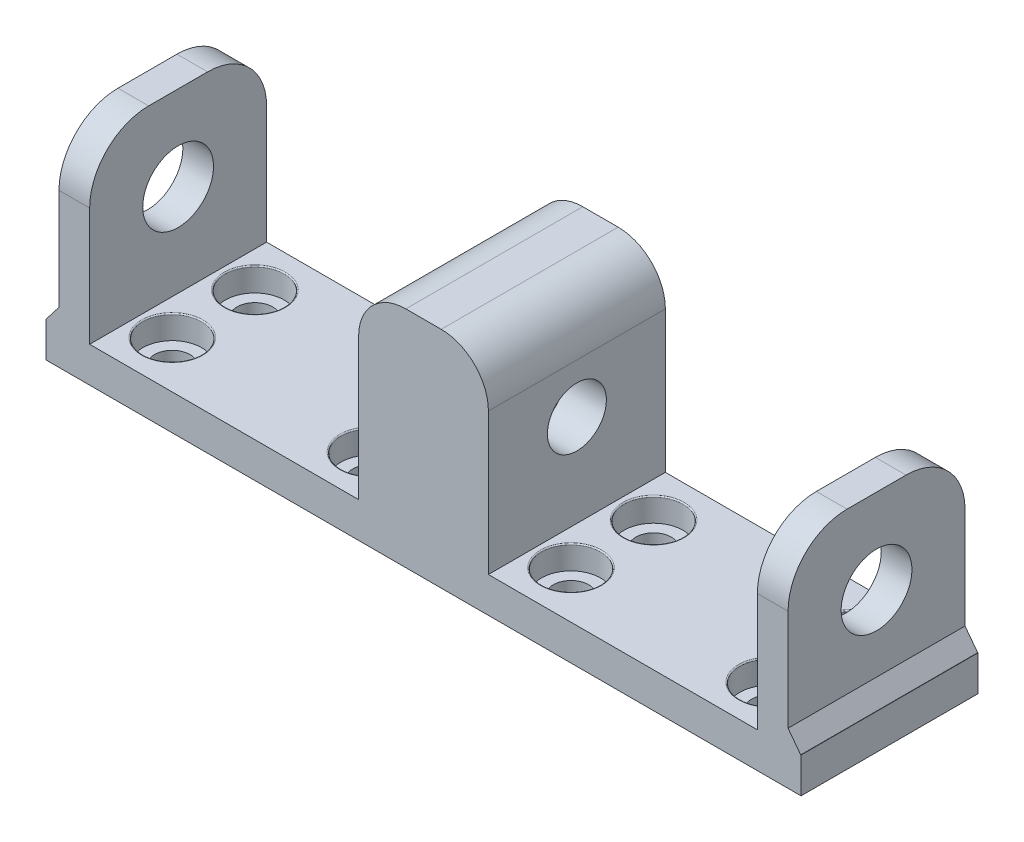
from build123d import *

# Parameters (mm, degrees)
SALIENTE_EXTRUIR1_DEPTH = 15
CROQUIS2_R              = 2.5
CORTAR_EXTRUIR1_DEPTH   = 3.5
CORTAR_EXTRUIR2_START   = -3.5
CROQUIS3_R              = 2.5
CORTAR_EXTRUIR2_DEPTH   = 3.5
CROQUIS4_R              = 2.5
CORTAR_EXTRUIR3_DEPTH   = 2
REDONDEO1_R             = 0.1
CROQUIS5_R              = 1.5
CORTAR_EXTRUIR4_DEPTH   = 25.763884994
CROQUIS6_W              = 15
CROQUIS6_H              = 3
SALIENTE_EXTRUIR2_DEPTH = 20.5
CROQUIS7_W              = 15
CROQUIS7_H              = 3
SALIENTE_EXTRUIR3_DEPTH = 20.5
CROQUIS8_W              = 2.6
CROQUIS8_H              = 15
SALIENTE_EXTRUIR4_DEPTH = 15
REDONDEO4_R             = 5
REDONDEO5_R             = 5
NERVIO1_REACH           = 36.213
CROQUIS17_WALL_W        = 72.20311249
CROQUIS17_WALL_H        = 15
NERVIO2_REACH           = 36.213
CROQUIS22_WALL_W        = 72.215787752
CROQUIS22_WALL_H        = 15
CROQUIS23_R             = 3
CORTAR_EXTRUIR5_DEPTH   = 7
CORTAR_EXTRUIR6_START   = -7
CROQUIS24_R             = 3
CORTAR_EXTRUIR6_DEPTH   = 7
CROQUIS27_R             = 1.5
CORTAR_EXTRUIR8_DEPTH   = 39.794329483
CROQUIS29_R             = 2.5
CORTAR_EXTRUIR9_DEPTH   = 2
REDONDEO6_R             = 0.1
CROQUIS30_R             = 1.5
CORTAR_EXTRUIR10_DEPTH  = 39.794329483
CROQUIS32_R             = 2.5
CORTAR_EXTRUIR11_DEPTH  = 2
REDONDEO7_R             = 0.1


with BuildPart() as part:
    # Croquis1 → Saliente-Extruir1 (new body)
    with BuildSketch(Plane.XY):
        with BuildLine():
            Line((-1.5, 9.5), (1.5, 9.5))
            ThreePointArc((1.5, 9.5), (4.328427125, 8.328427125), (5.5, 5.5))
            Line((5.5, 5.5), (5.5, -6.5))
            Line((5.5, -6.5), (11.5, -6.5))
            Line((11.5, -6.5), (11.5, -9.5))
            Line((11.5, -9.5), (5.5, -9.5))
            Line((5.5, -9.5), (-5.5, -9.5))
            Line((-5.5, -9.5), (-11.5, -9.5))
            Line((-11.5, -9.5), (-11.5, -6.5))
            Line((-11.5, -6.5), (-5.5, -6.5))
            Line((-5.5, -6.5), (-5.5, 5.5))
            ThreePointArc((-5.5, 5.5), (-4.328427125, 8.328427125), (-1.5, 9.5))
        make_face()
    extrude(amount=-SALIENTE_EXTRUIR1_DEPTH)

    # Croquis2 → Cortar-Extruir1 (cut)
    with BuildSketch(Plane(origin=(5.5, 0, 0), x_dir=(0, 0, -1), z_dir=(1, 0, 0))):
        with Locations((7.5, 1.32)):
            Circle(CROQUIS2_R)
    extrude(amount=-CORTAR_EXTRUIR1_DEPTH, mode=Mode.SUBTRACT)

    # Croquis3 → Cortar-Extruir2 (cut)
    with BuildSketch(Plane.ZY.offset(5.5).offset(CORTAR_EXTRUIR2_START)):
        with Locations((-7.5, 1.32)):
            Circle(CROQUIS3_R)
    extrude(amount=CORTAR_EXTRUIR2_DEPTH, mode=Mode.SUBTRACT)

    # Croquis4 → Cortar-Extruir3 (cut)
    with BuildSketch(Plane(origin=(0, -6.5, 0), x_dir=(1, 0, 0), z_dir=(0, 1, 0))):
        with Locations((-8.5, 11)):
            Circle(CROQUIS4_R)
        with Locations((-8.5, 4)):
            Circle(CROQUIS4_R)
        with Locations((8.5, 4)):
            Circle(CROQUIS4_R)
        with Locations((8.5, 11)):
            Circle(CROQUIS4_R)
    extrude(amount=-CORTAR_EXTRUIR3_DEPTH, mode=Mode.SUBTRACT)

    # Redondeo1
    redondeo1_edges = [part.edges().sort_by_distance(p)[0] for p in [
        (6, -6.5, -4),
        (6, -6.5, -11),
        (-11, -6.5, -4),
        (-11, -6.5, -11),
    ]]
    fillet(redondeo1_edges, radius=REDONDEO1_R)

    # Croquis5 → Cortar-Extruir4 (cut, through all)
    with BuildSketch(Plane(origin=(0, -6.5, 0), x_dir=(1, 0, 0), z_dir=(0, 1, 0))):
        with Locations((-8.5, 11)):
            Circle(CROQUIS5_R)
        with Locations((-8.5, 4)):
            Circle(CROQUIS5_R)
        with Locations((8.5, 4)):
            Circle(CROQUIS5_R)
        with Locations((8.5, 11)):
            Circle(CROQUIS5_R)
    extrude(amount=-CORTAR_EXTRUIR4_DEPTH, mode=Mode.SUBTRACT)

    # Croquis6 → Saliente-Extruir2 (add)
    with BuildSketch(Plane.ZY.offset(11.5)):
        with Locations((-7.5, -8)):
            Rectangle(CROQUIS6_W, CROQUIS6_H)
    extrude(amount=SALIENTE_EXTRUIR2_DEPTH)

    # Croquis7 → Saliente-Extruir3 (add)
    with BuildSketch(Plane(origin=(11.5, 0, 0), x_dir=(0, 0, -1), z_dir=(1, 0, 0))):
        with Locations((7.5, -8)):
            Rectangle(CROQUIS7_W, CROQUIS7_H)
    extrude(amount=SALIENTE_EXTRUIR3_DEPTH)

    # Croquis8 → Saliente-Extruir4 (add)
    with BuildSketch(Plane(origin=(0, -6.5, 0), x_dir=(1, 0, 0), z_dir=(0, 1, 0))):
        with Locations((-29.6, 7.5)):
            Rectangle(CROQUIS8_W, CROQUIS8_H)
        with Locations((29.6, 7.5)):
            Rectangle(CROQUIS8_W, CROQUIS8_H)
    extrude(amount=SALIENTE_EXTRUIR4_DEPTH)

    # Redondeo4
    redondeo4_edges = [part.edges().sort_by_distance(p)[0] for p in [
        (-29.6, 8.5, -15),
        (-29.6, 8.5, 0),
    ]]
    fillet(redondeo4_edges, radius=REDONDEO4_R)

    # Redondeo5
    redondeo5_edges = [part.edges().sort_by_distance(p)[0] for p in [
        (29.6, 8.5, -15),
        (29.6, 8.5, 0),
    ]]
    fillet(redondeo5_edges, radius=REDONDEO5_R)

    # Croquis17 wall → Nervio1 (add, up to next)
    with BuildSketch(Plane(origin=(31.436186969, -5.790917019, -7.5), x_dir=(0.603144816536, -0.797631700903, 0), z_dir=(0.797631700903, 0.603144816536, 0)), mode=Mode.PRIVATE) as nervio1_sk1:
        Rectangle(CROQUIS17_WALL_W, CROQUIS17_WALL_H)
    nervio1_tool1 = extrude(nervio1_sk1.sketch, amount=-NERVIO1_REACH, mode=Mode.PRIVATE) - part.part
    add(nervio1_tool1.solids().sort_by_distance((31.436186969, -5.790917019, -7.5))[0])

    # Croquis22 wall → Nervio2 (add, up to next)
    with BuildSketch(Plane(origin=(-31.446630364, -5.790917019, -7.5), x_dir=(0.61053978434, 0.791985588087, 0), z_dir=(-0.791985588087, 0.61053978434, 0)), mode=Mode.PRIVATE) as nervio2_sk1:
        Rectangle(CROQUIS22_WALL_W, CROQUIS22_WALL_H)
    nervio2_tool1 = extrude(nervio2_sk1.sketch, amount=-NERVIO2_REACH, mode=Mode.PRIVATE) - part.part
    add(nervio2_tool1.solids().sort_by_distance((-31.446630364, -5.790917019, -7.5))[0])

    # Croquis23 → Cortar-Extruir5 (cut)
    with BuildSketch(Plane(origin=(30.9, 0, 0), x_dir=(0, 0, -1), z_dir=(1, 0, 0))):
        with Locations((7.5, 1.32)):
            Circle(CROQUIS23_R)
    extrude(amount=-CORTAR_EXTRUIR5_DEPTH, mode=Mode.SUBTRACT)

    # Croquis24 → Cortar-Extruir6 (cut)
    with BuildSketch(Plane.ZY.offset(30.9).offset(CORTAR_EXTRUIR6_START)):
        with Locations((-7.5, 1.32)):
            Circle(CROQUIS24_R)
    extrude(amount=CORTAR_EXTRUIR6_DEPTH, mode=Mode.SUBTRACT)

    # Croquis27 → Cortar-Extruir8 (cut, through all)
    with BuildSketch(Plane(origin=(0, -6.5, 0), x_dir=(1, 0, 0), z_dir=(0, 1, 0))):
        with Locations((-25.3, 11)):
            Circle(CROQUIS27_R)
        with Locations((-25.3, 4)):
            Circle(CROQUIS27_R)
    extrude(amount=-CORTAR_EXTRUIR8_DEPTH, mode=Mode.SUBTRACT)

    # Croquis29 → Cortar-Extruir9 (cut)
    with BuildSketch(Plane(origin=(0, -6.5, 0), x_dir=(1, 0, 0), z_dir=(0, 1, 0))):
        with Locations((-25.3, 11)):
            Circle(CROQUIS29_R)
        with Locations((-25.3, 4)):
            Circle(CROQUIS29_R)
    extrude(amount=-CORTAR_EXTRUIR9_DEPTH, mode=Mode.SUBTRACT)

    # Redondeo6
    redondeo6_edges = [part.edges().sort_by_distance(p)[0] for p in [
        (-27.8, -6.5, -4),
        (-27.8, -6.5, -11),
    ]]
    fillet(redondeo6_edges, radius=REDONDEO6_R)

    # Croquis30 → Cortar-Extruir10 (cut, through all)
    with BuildSketch(Plane(origin=(0, -6.5, 0), x_dir=(1, 0, 0), z_dir=(0, 1, 0))):
        with Locations((25.3, 11)):
            Circle(CROQUIS30_R)
        with Locations((25.3, 4)):
            Circle(CROQUIS30_R)
    extrude(amount=-CORTAR_EXTRUIR10_DEPTH, mode=Mode.SUBTRACT)

    # Croquis32 → Cortar-Extruir11 (cut)
    with BuildSketch(Plane(origin=(0, -6.5, 0), x_dir=(1, 0, 0), z_dir=(0, 1, 0))):
        with Locations((25.3, 11)):
            Circle(CROQUIS32_R)
        with Locations((25.3, 4)):
            Circle(CROQUIS32_R)
    extrude(amount=-CORTAR_EXTRUIR11_DEPTH, mode=Mode.SUBTRACT)

    # Redondeo7
    redondeo7_edges = [part.edges().sort_by_distance(p)[0] for p in [
        (22.8, -6.5, -4),
        (22.8, -6.5, -11),
    ]]
    fillet(redondeo7_edges, radius=REDONDEO7_R)


solid = part.part
